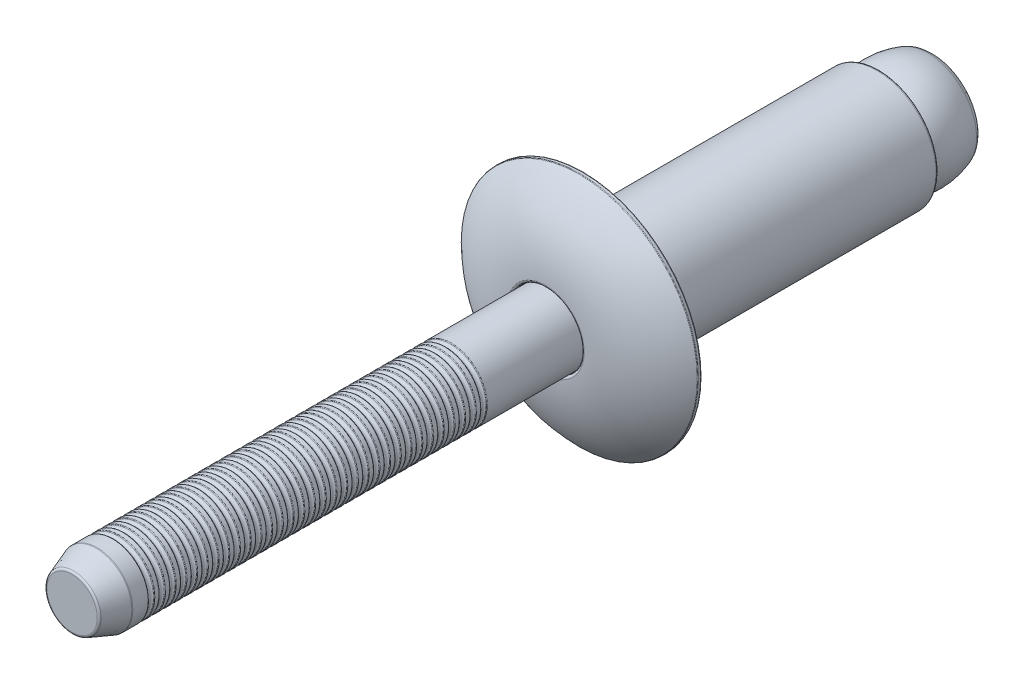
from build123d import *

# Parameters (mm, degrees)
SKETCH7_R          = 4.7625
SKETCH7_R_2        = 3.175
CUT_EXTRUDE1_DEPTH = 0.2032
FILLET1_R          = 0.127
FILLET2_R          = 0.5715
FILLET3_R          = 0.06096
CHAMFER1_SIZE      = 0.2032
SKETCH6_R          = 0.1438275
LPATTERN2_COUNT    = 32
LPATTERN2_PITCH    = 0.57531


with BuildPart() as part:
    # Sketch2 → Revolve1 (revolve)
    with BuildSketch(Plane(origin=(0, 0, 0), x_dir=(0, 0, -1), z_dir=(1, 0, 0))):
        with BuildLine():
            Line((-23.39975, 0), (-23.39975, 1.9177))
            Line((-23.39975, 1.9177), (2.00025, 1.9177))
            Line((2.00025, 1.9177), (3.82905, 1.9177))
            Line((3.82905, 1.9177), (3.82905, 1.9431))
            Line((3.82905, 1.9431), (2.000301322, 1.9431))
            ThreePointArc((2.000301322, 1.9431), (2.480266056, 4.326818668), (3.82905, 6.35))
            Line((3.82905, 6.35), (4.03225, 6.35))
            Line((4.03225, 6.35), (4.03225, 3.175))
            Line((4.03225, 3.175), (19.90725, 3.175))
            Line((19.90725, 3.175), (19.90725, 2.8575))
            Line((19.90725, 2.8575), (19.58975, 2.54))
            ThreePointArc((19.58975, 2.54), (21.154309526, 2.8575), (22.718869053, 2.54))
            ThreePointArc((22.718869053, 2.54), (23.226577012, 1.314838285), (23.39975, 0))
            Line((23.39975, 0), (-23.39975, 0))
        make_face()
    revolve(axis=Axis((0, 0, -23.39975), (0, 0, 1)))

    # Sketch7 → Cut-Extrude1 (cut)
    with BuildSketch(Plane(origin=(0, 0, -4.03225), x_dir=(-1, 0, 0), z_dir=(0, 0, -1))):
        with Locations(Location((0, 0, 0), (0, 0, 90))):
            Circle(SKETCH7_R)
        with Locations(Location((0, 0, 0), (0, 0, 90))):
            Circle(SKETCH7_R_2, mode=Mode.SUBTRACT)
    extrude(amount=-CUT_EXTRUDE1_DEPTH, mode=Mode.SUBTRACT)

    # Sketch8 → Cut-Revolve3 (revolve, cut)
    with BuildSketch(Plane(origin=(0, 0, 0), x_dir=(0, 0, -1), z_dir=(1, 0, 0))):
        Polygon((-23.39975, 1.438275), (-22.082540638, 1.9177), (-23.39975, 1.9177), align=None)
    revolve(axis=Axis((0, 0, 23.39975), (0, 0, -1)), mode=Mode.SUBTRACT)

    # Fillet1
    fillet1_edges = [part.edges().sort_by_distance(p)[0] for p in [
        (0, -2.8575, -19.90725),
        (0, -3.175, -19.90725),
        (0, -1.9431, -2.000301322),
        (0, -3.175, -3.82905),
        (0, -1.9177, 22.082540638),
        (0, -1.438275, 23.39975),
    ]]
    fillet(fillet1_edges, radius=FILLET1_R)

    # Fillet2
    fillet2_edges = [part.edges().sort_by_distance(p)[0] for p in [
        (0, -2.54, -22.718869053),
    ]]
    fillet(fillet2_edges, radius=FILLET2_R)

    # Fillet3
    fillet3_edges = [part.edges().sort_by_distance(p)[0] for p in [
        (0, -6.35, -4.03225),
        (0, -6.35, -3.82905),
    ]]
    fillet(fillet3_edges, radius=FILLET3_R)

    # Chamfer1
    chamfer1_edges = [part.edges().sort_by_distance(p)[0] for p in [
        (0, -4.7625, -3.82905),
    ]]
    chamfer(chamfer1_edges, length=CHAMFER1_SIZE - 0.0001)  # a hair under: the kernel refuses the full size

    # Sketch6 → Cut-Revolve2 (revolve, cut)
    with BuildSketch(Plane(origin=(0, 0, 0), x_dir=(0, 0, -1), z_dir=(1, 0, 0))):
        with Locations((-3.2235775, 1.9177)):
            Circle(SKETCH6_R)
    cut_revolve2 = revolve(axis=Axis((0, 0, 23.39975), (0, 0, -1)), mode=Mode.SUBTRACT)

    # Fillet4: read off the stored shape, not the designer's step
    # Fillet4 outline → Fillet4 (revolve, cut)
    with BuildSketch(Plane.XZ):
        with BuildLine():
            ThreePointArc((1.887579058, 3.082939388), (1.909227792, 3.069638464), (1.9177, 3.045684259))
            Line((1.9177, 3.045684259), (1.9177, 3.082939388))
            Line((1.9177, 3.082939388), (1.887579058, 3.082939388))
        make_face()
        with BuildLine():
            ThreePointArc((1.9177, 3.401470741), (1.909227792, 3.377516536), (1.887579058, 3.364215612))
            Line((1.887579058, 3.364215612), (1.9177, 3.364215612))
            Line((1.9177, 3.364215612), (1.9177, 3.401470741))
        make_face()
    fillet4 = revolve(axis=Axis((0, 0, 0), (0, 0, 1)), mode=Mode.SUBTRACT)

    # LPattern2: Cut-Revolve2, Fillet4 ×32
    with Locations(*[(0, 0, i * LPATTERN2_PITCH) for i in range(1, LPATTERN2_COUNT)]):
        add(cut_revolve2, mode=Mode.SUBTRACT)
        add(fillet4, mode=Mode.SUBTRACT)


solid = part.part
